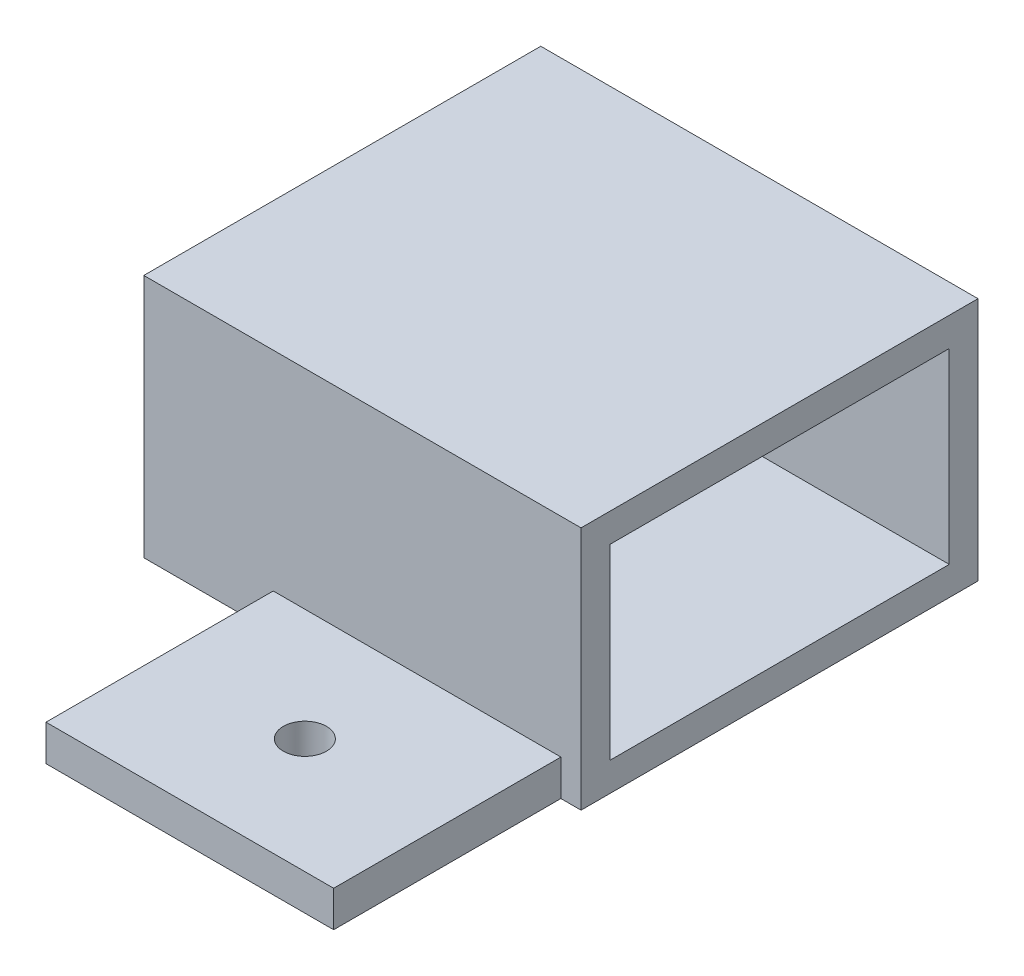
from build123d import *

# Parameters (mm, degrees)
S_BOX1_W       = 20
S_BOX1_H       = 2.5
BOSS_1_DEPTH   = 42
S_BOX2_W       = 30.4
S_BOX2_H       = 17
BOSS_2_DEPTH   = 27.6
S_CUT3_W       = 30.6
S_CUT3_H       = 13
POCKET_3_DEPTH = 23.6
S_HOLE4_R      = 1.5
HOLE_4_DEPTH   = 2.7


with BuildPart() as part:
    # S_box1 → Boss_1 (new body)
    with BuildSketch(Plane.XY.offset(-34)):
        with Locations((0, 2.75)):
            Rectangle(S_BOX1_W, S_BOX1_H)
    extrude(amount=BOSS_1_DEPTH)

    # S_box2 → Boss_2 (add)
    with BuildSketch(Plane.XY.offset(-35.4)):
        with Locations((-3.8, 10)):
            Rectangle(S_BOX2_W, S_BOX2_H)
    extrude(amount=BOSS_2_DEPTH)

    # S_cut3 → Pocket_3 (cut)
    with BuildSketch(Plane.XY.offset(-33.4)):
        with Locations((-3.8, 10)):
            Rectangle(S_CUT3_W, S_CUT3_H)
    extrude(amount=POCKET_3_DEPTH, mode=Mode.SUBTRACT)

    # S_hole4 → Hole_4 (cut)
    with BuildSketch(Plane(origin=(0, 1.4, 0), x_dir=(1, 0, 0), z_dir=(0, 1, 0))):
        Circle(S_HOLE4_R)
    extrude(amount=HOLE_4_DEPTH, mode=Mode.SUBTRACT)


solid = part.part
